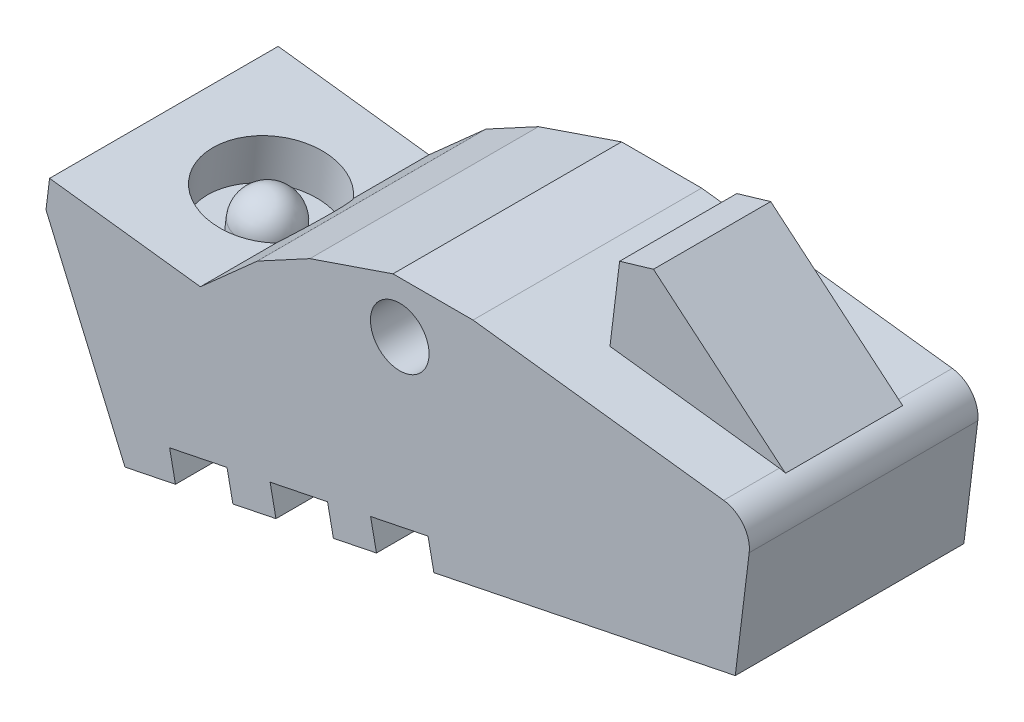
from build123d import *

# Parameters (mm, degrees)
SKETCH_2_R          = 1
EXTRUDE_2_DEPTH     = 7.8
SKETCH_3_W          = 6
SKETCH_3_H          = 4
EXTRUDE_3_DEPTH     = 4
CHAMFER_1_SIZE      = 1.3
CHAMFER_1_SIZE2     = 3
CHAMFER_2_SIZE      = 6.159459855
CHAMFER_2_SIZE_2    = 4
SKETCH_4_R          = 2
CUT_EXTRUDE_1_DEPTH = 1.5
SKETCH_5_R          = 1
EXTRUDE_4_DEPTH     = 1.5
FILLET_1_R          = 1
SKETCH_6_W          = 2
SKETCH_6_H          = 7.8
CUT_EXTRUDE_2_DEPTH = 1
FILLET_START        = -1
FILLET_2_DEPTH      = 10
FILLET_2_2_DEPTH    = 2.9
FILLET_START_2      = 5.9
FILLET_2_3_DEPTH    = 3.1


with BuildPart() as part:
    # 스케치2 → 보스-돌출2 (new body)
    with BuildSketch(Plane.XY):
        Polygon((2.5, 1.75), (12.045629808, 0.577944035), (11.448632524, -4.284208661), (-9.375446541, -8.532579884), (-12.070254037, -2.279394966), (-11.94829225, -1.286095926), (-6.802600831, -1.917907388), (-4.857687993, -0.185790939), (-3.065051347, 0.78210453), (-0.230903775, 1.75), align=None)
        Circle(SKETCH_2_R, mode=Mode.SUBTRACT)
    extrude(amount=EXTRUDE_2_DEPTH)

    # 스케치3 → 보스-돌출3 (add)
    with BuildSketch(Plane(origin=(0.248812001, 2.02641113, 0), x_dir=(0.9925461516413224, -0.12186934340514406, 0), z_dir=(0.12186934340514406, 0.9925461516413224, 0))):
        with Locations((8.062111671, -3.9)):
            Rectangle(SKETCH_3_W, SKETCH_3_H)
    extrude(amount=EXTRUDE_3_DEPTH)

    # 모따기1
    chamfer_1_edges = [part.edges().sort_by_distance(p)[0] for p in [
        (5.760668833, 5.379679511, 3.9),
    ]]
    chamfer_1_side = [part.faces().sort_by_distance(p)[0] for p in [
        (5.516930146, 3.394587208, 3.9),
    ]]
    chamfer(chamfer_1_edges, length=CHAMFER_1_SIZE, length2=CHAMFER_1_SIZE2, reference=chamfer_1_side[0])

    # 모따기2
    # the kernel refuses this chamfer: 6.159459855, 4 mm, written as the material it takes off along each edge
    with BuildSketch(Plane(origin=(9.288459468, -15.121825718, 5.9), x_dir=(-0.9925461516413224, 0.12186934340514405, 0), z_dir=(0.12186934340514406, 0.9925461516413224, 0))) as chamfer_2_piece_1_section:
        Polygon((CHAMFER_2_SIZE, 0), (0, -CHAMFER_2_SIZE_2), (0, 0), align=None)
    chamfer_2_piece_1 = extrude(amount=35.837521179, mode=Mode.PRIVATE)
    chamfer_2_piece_1 = split(chamfer_2_piece_1, bisect_by=Plane(origin=(17.870057149, -4.894675852, 5.9), z_dir=(0.6427876096865351, 0.7660444431189816, 0)), keep=Keep.TOP, mode=Mode.PRIVATE)
    add(chamfer_2_piece_1, mode=Mode.SUBTRACT)
    with BuildSketch(Plane(origin=(9.288459468, -15.121825718, 1.9), x_dir=(-0.9925461516413225, 0.12186934340514408, 0), z_dir=(0.12186934340514406, 0.9925461516413224, 0))) as chamfer_2_piece_2_section:
        Polygon((CHAMFER_2_SIZE, 0), (0, CHAMFER_2_SIZE_2), (0, 0), align=None)
    chamfer_2_piece_2 = extrude(amount=35.837521179, mode=Mode.PRIVATE)
    chamfer_2_piece_2 = split(chamfer_2_piece_2, bisect_by=Plane(origin=(17.870057149, -4.894675852, 1.9), z_dir=(0.6427876096865351, 0.7660444431189816, 0)), keep=Keep.TOP, mode=Mode.PRIVATE)
    add(chamfer_2_piece_2, mode=Mode.SUBTRACT)
    with BuildSketch(Plane(origin=(11.715945743, 4.648463451, -14.01876059), x_dir=(-0.9925461516413225, 0.1218693434051441, 0), z_dir=(0, 0, 1))) as chamfer_2_piece_3:
        Polygon((CHAMFER_2_SIZE, 0), (0, CHAMFER_2_SIZE_2), (0, 0), align=None)
    extrude(amount=35.837521179, mode=Mode.SUBTRACT)

    # 스케치4 → 컷-돌출1 (cut, symmetric)
    with BuildSketch(Plane(origin=(-0.333025054, -2.712271409, 0), x_dir=(0.9925461516413224, -0.12186934340514398, 0), z_dir=(0.12186934340514398, 0.9925461516413224, 0))):
        with Locations(Location((-8.018161162, -3.9, 0), (0, 0, 180))):
            Circle(SKETCH_4_R)
    extrude(amount=CUT_EXTRUDE_1_DEPTH, both=True, mode=Mode.SUBTRACT)

    # 스케치5 → 보스-돌출4 (add)
    with BuildSketch(Plane(origin=(-0.515829069, -4.201090636, 0), x_dir=(0.9925461516413224, -0.12186934340514398, 0), z_dir=(0.12186934340514398, 0.9925461516413224, 0))):
        with Locations(Location((-8.018161162, -3.9, 0), (0, 0, 180))):
            Circle(SKETCH_5_R)
    extrude(amount=EXTRUDE_4_DEPTH)

    # 필렛1
    fillet_1_edges = [part.edges().sort_by_distance(p)[0] for p in [
        (-7.298873907, -1.856972716, 3.9),
    ]]
    fillet(fillet_1_edges, radius=FILLET_1_R)

    # 스케치6 → 컷-돌출2 (cut)
    with BuildSketch(Plane(origin=(1.296571576, -6.355355406, 0), x_dir=(0.9798173389697206, 0.19989492803544545, 0), z_dir=(0.19989492803544545, -0.9798173389697206, 0))):
        with Locations((-8.133925678, 3.9)):
            Rectangle(SKETCH_6_W, SKETCH_6_H)
        with Locations((-4.633925678, 3.9)):
            Rectangle(SKETCH_6_W, SKETCH_6_H)
        with Locations((-1.133925678, 3.9)):
            Rectangle(SKETCH_6_W, SKETCH_6_H)
    extrude(amount=-CUT_EXTRUDE_2_DEPTH, mode=Mode.SUBTRACT)

    # 필렛2: read off the stored shape, not the designer's step
    # 필렛2 outline → 필렛2 (cut)
    with BuildSketch(Plane.XY.offset(FILLET_START)):
        with BuildLine():
            Line((11.228468369, 0.678278844), (11.260303349, 0.651566124))
            ThreePointArc((11.260303349, 0.651566124), (11.780248218, 0.235605593), (11.923760465, -0.414602116))
            Line((11.923760465, -0.414602116), (12.045629808, 0.577944035))
            Line((12.045629808, 0.577944035), (11.228468369, 0.678278844))
        make_face()
    extrude(amount=FILLET_2_DEPTH, mode=Mode.SUBTRACT)

    # Fillet 2 2 outline → Fillet 2 2 (cut)
    with BuildSketch(Plane.XY.offset(FILLET_START)):
        with BuildLine():
            Line((11.228468369, 0.678278844), (11.053083657, 0.699813379))
            ThreePointArc((11.053083657, 0.699813379), (11.157980304, 0.6812165), (11.260303349, 0.651566124))
            Line((11.260303349, 0.651566124), (11.228468369, 0.678278844))
        make_face()
    extrude(amount=FILLET_2_2_DEPTH, mode=Mode.SUBTRACT)

    # Fillet 2 3 outline → Fillet 2 3 (cut)
    with BuildSketch(Plane.XY.offset(FILLET_START_2)):
        with BuildLine():
            Line((11.228468369, 0.678278844), (11.053083657, 0.699813379))
            ThreePointArc((11.053083657, 0.699813379), (11.157980304, 0.6812165), (11.260303349, 0.651566124))
            Line((11.260303349, 0.651566124), (11.228468369, 0.678278844))
        make_face()
    extrude(amount=FILLET_2_3_DEPTH, mode=Mode.SUBTRACT)


solid = part.part
